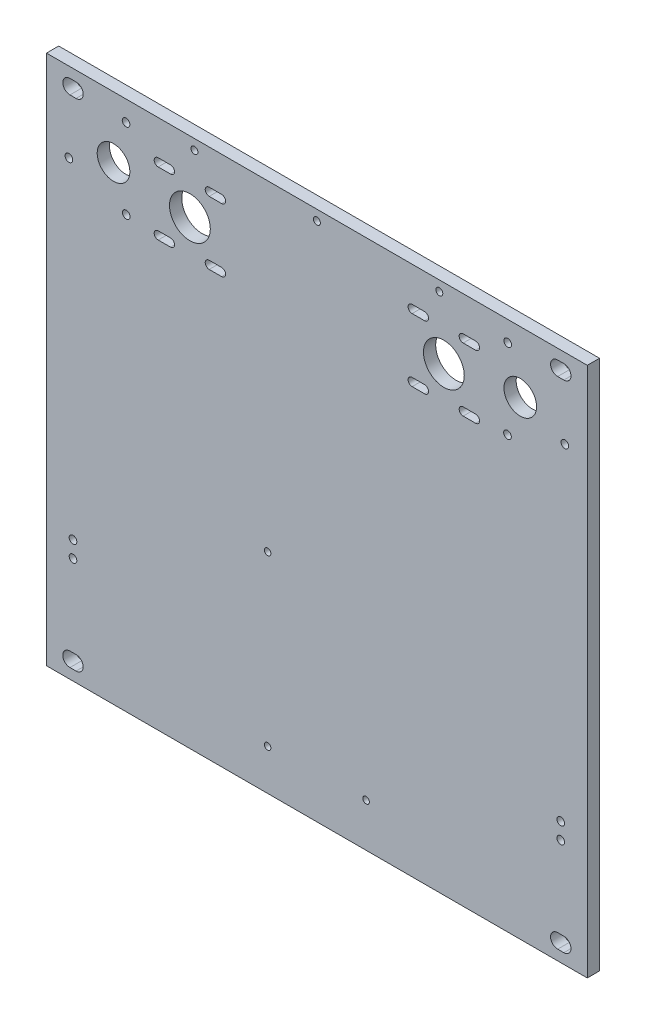
from build123d import *

# Parameters (mm, degrees)
CROQUIS1_W                        = 265
CROQUIS1_H                        = 260
BRIDA_BASE1_DEPTH                 = 6
TALADRO_DE_MARGEN_PARA_M181_D     = 20
DI_METRO_DE_TALADRO_16_0_16_1_D   = 16
RANURA_START                      = -6
RANURA_DE_MARGEN_PARA_M3_54_DEPTH = 6
TALADRO_DE_MARGEN_PARA_M31_D      = 3.75
CORTAR_EXTRUIR1_DEPTH             = 186.72089274
CORTAR_EXTRUIR1_DEPTH_BACK        = 186.72089274
CROQUIS23_R                       = 1.875
CORTAR_EXTRUIR3_DEPTH             = 186.72089274
CORTAR_EXTRUIR3_DEPTH_BACK        = 186.72089274
CROQUIS29_R                       = 1.6
RANURA_DE_MARGEN_PARA_M61_DEPTH   = 6
TALADRO_DE_MARGEN_PARA_M32_D      = 3.4


# Read off the part's stored shape, not the designer's step: Ranura de margen para M3.54, Ranura de margen para M61
# Sheet-metal steps are written as plain solids
with BuildPart() as part:
    # Croquis1 → Brida base1 (new body)
    with BuildSketch(Plane.XY):
        Rectangle(CROQUIS1_W, CROQUIS1_H)
    extrude(amount=-BRIDA_BASE1_DEPTH)

    # Taladro de margen para M181 (through all)
    with Locations(Plane.XY):
        with Locations((62.219531128, 95.5), (-62.219531128, 95.5)):
            Hole(TALADRO_DE_MARGEN_PARA_M181_D / 2)

    # Diámetro de taladro Ø16.0 (16)1 (through all)
    with Locations(Plane(origin=(0, 0, -6), x_dir=(-1, 0, 0), z_dir=(0, 0, -1))):
        with Locations((-99.65, 100), (99.65, 100)):
            Hole(DI_METRO_DE_TALADRO_16_0_16_1_D / 2)

    # Ranura de margen para M3.54 outline → Ranura de margen para M3.54 (cut)
    with BuildSketch(Plane.XY.offset(RANURA_START)):
        with BuildLine():
            ThreePointArc((52.769531128, 78.05), (54.719531128, 80), (52.769531128, 81.95))
            Line((52.769531128, 81.95), (46.669531128, 81.95))
            ThreePointArc((46.669531128, 81.95), (44.719531128, 80), (46.669531128, 78.05))
            Line((46.669531128, 78.05), (52.769531128, 78.05))
        make_face()
        with BuildLine():
            ThreePointArc((71.669531128, 81.95), (69.719531128, 80), (71.669531128, 78.05))
            Line((71.669531128, 78.05), (77.769531128, 78.05))
            ThreePointArc((77.769531128, 78.05), (79.719531128, 80), (77.769531128, 81.95))
            Line((77.769531128, 81.95), (71.669531128, 81.95))
        make_face()
        with BuildLine():
            ThreePointArc((-77.769531128, 81.95), (-79.719531128, 80), (-77.769531128, 78.05))
            Line((-77.769531128, 78.05), (-71.669531128, 78.05))
            ThreePointArc((-71.669531128, 78.05), (-69.719531128, 80), (-71.669531128, 81.95))
            Line((-71.669531128, 81.95), (-77.769531128, 81.95))
        make_face()
        with BuildLine():
            ThreePointArc((-52.769531128, 81.95), (-54.719531128, 80), (-52.769531128, 78.05))
            Line((-52.769531128, 78.05), (-46.669531128, 78.05))
            ThreePointArc((-46.669531128, 78.05), (-44.719531128, 80), (-46.669531128, 81.95))
            Line((-46.669531128, 81.95), (-52.769531128, 81.95))
        make_face()
        with BuildLine():
            ThreePointArc((77.769531128, 109.05), (79.719531128, 111), (77.769531128, 112.95))
            Line((77.769531128, 112.95), (71.669531128, 112.95))
            ThreePointArc((71.669531128, 112.95), (69.719531128, 111), (71.669531128, 109.05))
            Line((71.669531128, 109.05), (77.769531128, 109.05))
        make_face()
        with BuildLine():
            ThreePointArc((46.669531128, 112.95), (44.719531128, 111), (46.669531128, 109.05))
            Line((46.669531128, 109.05), (52.769531128, 109.05))
            ThreePointArc((52.769531128, 109.05), (54.719531128, 111), (52.769531128, 112.95))
            Line((52.769531128, 112.95), (46.669531128, 112.95))
        make_face()
        with BuildLine():
            ThreePointArc((-52.769531128, 112.95), (-54.719531128, 111), (-52.769531128, 109.05))
            Line((-52.769531128, 109.05), (-46.669531128, 109.05))
            ThreePointArc((-46.669531128, 109.05), (-44.719531128, 111), (-46.669531128, 112.95))
            Line((-46.669531128, 112.95), (-52.769531128, 112.95))
        make_face()
        with BuildLine():
            ThreePointArc((-77.769531128, 112.95), (-79.719531128, 111), (-77.769531128, 109.05))
            Line((-77.769531128, 109.05), (-71.669531128, 109.05))
            ThreePointArc((-71.669531128, 109.05), (-69.719531128, 111), (-71.669531128, 112.95))
            Line((-71.669531128, 112.95), (-77.769531128, 112.95))
        make_face()
    extrude(amount=RANURA_DE_MARGEN_PARA_M3_54_DEPTH, mode=Mode.SUBTRACT)

    # Taladro de margen para M31 (through all)
    with Locations(Plane(origin=(0, 0, -6), x_dir=(-1, 0, 0), z_dir=(0, 0, -1))):
        with Locations((-93.405002002, 81), (-121.5, 91.02623214), (-93.5, 120.079280366)):
            taladro_de_margen_para_m31 = Hole(TALADRO_DE_MARGEN_PARA_M31_D / 2)

    # Simetría1: Taladro de margen para M31 across plane
    add(taladro_de_margen_para_m31.mirror(Plane(origin=(0, 0, 0), x_dir=(0, 0, 1), z_dir=(1, 0, 0))), mode=Mode.SUBTRACT)

    # Croquis23 → Cortar-Extruir1 (cut, two sides: drawn at the far end of the back side and taken through both)
    with BuildSketch(Plane.XY.offset(-CORTAR_EXTRUIR1_DEPTH_BACK)):
        with Locations((-119.5, -70)):
            Circle(CROQUIS23_R)
        with Locations((-119.5, -78)):
            Circle(CROQUIS23_R)
        with Locations((119.5, -78)):
            Circle(CROQUIS23_R)
        with Locations((119.5, -70)):
            Circle(CROQUIS23_R)
    extrude(amount=CORTAR_EXTRUIR1_DEPTH + CORTAR_EXTRUIR1_DEPTH_BACK, mode=Mode.SUBTRACT)

    # Croquis29 → Cortar-Extruir3 (cut, two sides: drawn at the far end of the back side and taken through both)
    with BuildSketch(Plane(origin=(0, 0, -6), x_dir=(-1, 0, 0), z_dir=(0, 0, -1)).offset(-CORTAR_EXTRUIR3_DEPTH_BACK)):
        with Locations((24.13, -110)):
            Circle(CROQUIS29_R)
        with Locations((-24.13, -108.73)):
            Circle(CROQUIS29_R)
        with Locations((24.13, -27.45)):
            Circle(CROQUIS29_R)
    extrude(amount=CORTAR_EXTRUIR3_DEPTH + CORTAR_EXTRUIR3_DEPTH_BACK, mode=Mode.SUBTRACT)

    # Ranura de margen para M61 outline → Ranura de margen para M61 (cut)
    with BuildSketch(Plane.XY.offset(RANURA_START)):
        with BuildLine():
            ThreePointArc((-118, 118), (-114.5, 121.5), (-118, 125))
            Line((-118, 125), (-121, 125))
            ThreePointArc((-121, 125), (-124.5, 121.5), (-121, 118))
            Line((-121, 118), (-118, 118))
        make_face()
        with BuildLine():
            ThreePointArc((118, 125), (114.5, 121.5), (118, 118))
            Line((118, 118), (121, 118))
            ThreePointArc((121, 118), (124.5, 121.5), (121, 125))
            Line((121, 125), (118, 125))
        make_face()
        with BuildLine():
            ThreePointArc((121, -125), (124.5, -121.5), (121, -118))
            Line((121, -118), (118, -118))
            ThreePointArc((118, -118), (114.5, -121.5), (118, -125))
            Line((118, -125), (121, -125))
        make_face()
        with BuildLine():
            ThreePointArc((-121, -118), (-124.5, -121.5), (-121, -125))
            Line((-121, -125), (-118, -125))
            ThreePointArc((-118, -125), (-114.5, -121.5), (-118, -118))
            Line((-118, -118), (-121, -118))
        make_face()
    extrude(amount=RANURA_DE_MARGEN_PARA_M61_DEPTH, mode=Mode.SUBTRACT)

    # Taladro de margen para M32 (through all)
    with Locations(Plane(origin=(0, 0, -6), x_dir=(-1, 0, 0), z_dir=(0, 0, -1))):
        with Locations((60, 125), (0, 125), (-60, 125)):
            Hole(TALADRO_DE_MARGEN_PARA_M32_D / 2)


solid = part.part
